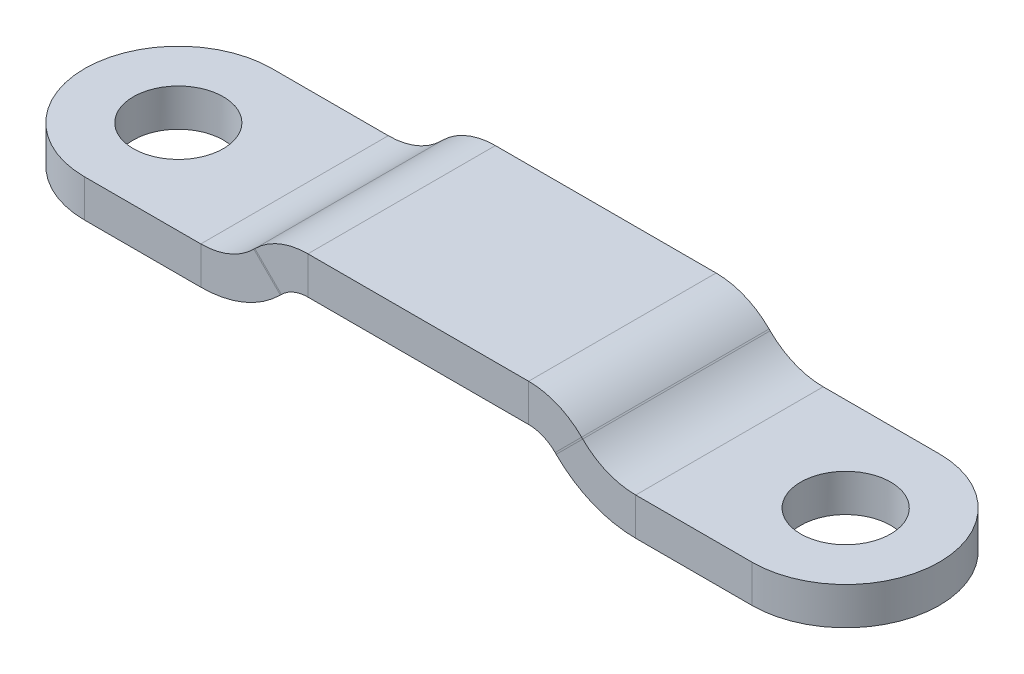
from build123d import *

# Parameters (mm, degrees)
BASE_FLANGE1_DEPTH = 25
SKETCH6_R          = 6
CUT_EXTRUDE1_DEPTH = 10


# Sheet-metal steps are written as plain solids
with BuildPart() as part:
    # Sketch1 → Base-Flange1 (new body)
    with BuildSketch(Plane.XY):
        with BuildLine():
            Line((-57, 0), (-29, 0))
            ThreePointArc((-29, 0), (-25.173165676, 0.761204675), (-21.928932188, 2.928932188))
            Line((-21.928932188, 2.928932188), (-21.786796564, 3.071067812))
            ThreePointArc((-21.786796564, 3.071067812), (-18.542563076, 5.238795325), (-14.715728753, 6))
            Line((-14.715728753, 6), (14.715728753, 6))
            ThreePointArc((14.715728753, 6), (18.542563076, 5.238795325), (21.786796564, 3.071067812))
            Line((21.786796564, 3.071067812), (21.928932188, 2.928932188))
            ThreePointArc((21.928932188, 2.928932188), (25.173165676, 0.761204675), (29, 0))
            Line((29, 0), (57, 0))
            Line((57, 0), (57, -5))
            Line((57, -5), (29, -5))
            ThreePointArc((29, -5), (23.259748515, -3.858192988), (18.393398282, -0.606601718))
            Line((18.393398282, -0.606601718), (18.251262658, -0.464466094))
            ThreePointArc((18.251262658, -0.464466094), (16.629145914, 0.619397663), (14.715728753, 1))
            Line((14.715728753, 1), (-14.715728753, 1))
            ThreePointArc((-14.715728753, 1), (-16.629145914, 0.619397663), (-18.251262658, -0.464466094))
            Line((-18.251262658, -0.464466094), (-18.393398282, -0.606601718))
            ThreePointArc((-18.393398282, -0.606601718), (-23.259748515, -3.858192988), (-29, -5))
            Line((-29, -5), (-57, -5))
            Line((-57, -5), (-57, 0))
        make_face()
    extrude(amount=BASE_FLANGE1_DEPTH)

    # Sketch6 → Cut-Extrude1 (cut)
    with BuildSketch(Plane(origin=(0, 0, 0), x_dir=(1, 0, 0), z_dir=(0, 1, 0))):
        with BuildLine():
            ThreePointArc((-44.5, -25), (-53.338834765, -21.338834765), (-57, -12.5))
            Line((-57, -12.5), (-57, -25))
            Line((-57, -25), (-44.5, -25))
        make_face()
        with BuildLine():
            Line((-44.5, 0), (-57, 0))
            Line((-57, 0), (-57, -12.5))
            ThreePointArc((-57, -12.5), (-53.338834765, -3.661165235), (-44.5, 0))
        make_face()
        with Locations(Location((-44.5, -12.5, 0), (0, 0, 270))):
            Circle(SKETCH6_R)
        with Locations(Location((44.5, -12.5, 0), (0, 0, 270))):
            Circle(SKETCH6_R)
        with BuildLine():
            ThreePointArc((44.5, 0), (53.338834765, -3.661165235), (57, -12.5))
            Line((57, -12.5), (57, 0))
            Line((57, 0), (44.5, 0))
        make_face()
        with BuildLine():
            Line((44.5, -25), (57, -25))
            Line((57, -25), (57, -12.5))
            ThreePointArc((57, -12.5), (53.338834765, -21.338834765), (44.5, -25))
        make_face()
    extrude(amount=-CUT_EXTRUDE1_DEPTH, mode=Mode.SUBTRACT)


solid = part.part
